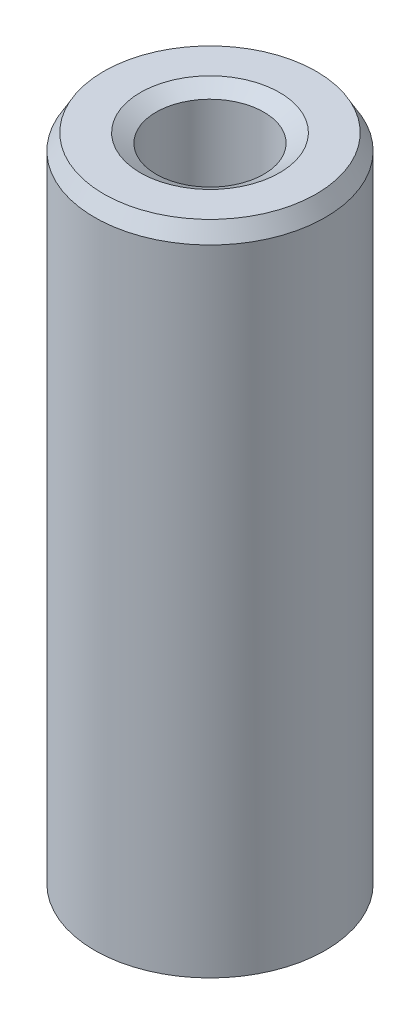
from build123d import *
from OCP.BRepFilletAPI import BRepFilletAPI_MakeChamfer

# Parameters (mm, degrees)
SKETCH1_R           = 5
BOSS_EXTRUDE1_DEPTH = 28.589756123
SKETCH2_R           = 2.334051873
CUT_EXTRUDE1_DEPTH  = 30.451216531
CHAMFER1_SIZE       = 0.683187299
CHAMFER1_SIZE2      = 0.394438371


with BuildPart() as part:
    # Sketch1 → Boss-Extrude1 (new body)
    with BuildSketch(Plane(origin=(0, 0, 0), x_dir=(1, 0, 0), z_dir=(0, 1, 0))):
        Circle(SKETCH1_R)
    extrude(amount=BOSS_EXTRUDE1_DEPTH)

    # Sketch2 → Cut-Extrude1 (cut, through all)
    with BuildSketch(Plane(origin=(0, 0, 0), x_dir=(1, 0, 0), z_dir=(0, 1, 0))):
        Circle(SKETCH2_R)
    extrude(amount=CUT_EXTRUDE1_DEPTH, mode=Mode.SUBTRACT)

    # Chamfer1: one chamfer whose edges measure the first distance from different faces: ONE call of the kernel's chamfer builder (chamfer() names one face for all edges)
    chamfer1_edges_1 = [part.edges().sort_by_distance(p)[0] for p in [
        (-2.334051873, 28.589756123, 0),
    ]]
    chamfer1_side_1 = [part.faces().sort_by_distance(p)[0] for p in [
        (-4.858578644, 28.589756123, 0),
    ]]
    chamfer1_edges_2 = [part.edges().sort_by_distance(p)[0] for p in [
        (-2.334051873, 0, 0),
    ]]
    chamfer1_side_2 = [part.faces().sort_by_distance(p)[0] for p in [
        (-2.334051873, 14.294878061, 0),
    ]]
    chamfer1_edges_3 = [part.edges().sort_by_distance(p)[0] for p in [
        (-5, 0, 0),
    ]]
    chamfer1_side_3 = [part.faces().sort_by_distance(p)[0] for p in [
        (-4.858578644, 0, 0),
    ]]
    chamfer1_edges_4 = [part.edges().sort_by_distance(p)[0] for p in [
        (-5, 28.589756123, 0),
    ]]
    chamfer1_side_4 = [part.faces().sort_by_distance(p)[0] for p in [
        (-5, 14.294878061, 0),
    ]]
    chamfer1 = BRepFilletAPI_MakeChamfer(part.part.solid().wrapped)
    for e in chamfer1_edges_1:
        chamfer1.Add(CHAMFER1_SIZE, CHAMFER1_SIZE2, e.wrapped, chamfer1_side_1[0].wrapped)  # the first distance lies on this face
    for e in chamfer1_edges_2:
        chamfer1.Add(CHAMFER1_SIZE, CHAMFER1_SIZE2, e.wrapped, chamfer1_side_2[0].wrapped)  # the first distance lies on this face
    for e in chamfer1_edges_3:
        chamfer1.Add(CHAMFER1_SIZE, CHAMFER1_SIZE2, e.wrapped, chamfer1_side_3[0].wrapped)  # the first distance lies on this face
    for e in chamfer1_edges_4:
        chamfer1.Add(CHAMFER1_SIZE, CHAMFER1_SIZE2, e.wrapped, chamfer1_side_4[0].wrapped)  # the first distance lies on this face
    add(Compound.cast(chamfer1.Shape()), mode=Mode.REPLACE)


solid = part.part
